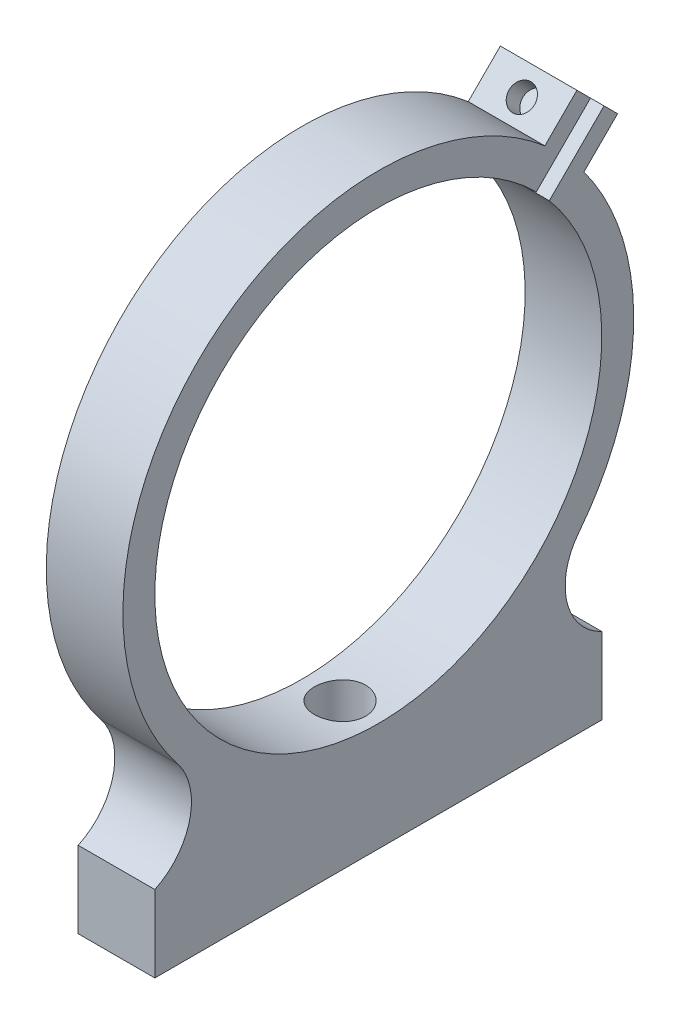
from build123d import *

# Parameters (mm, degrees)
SKETCH_1_W          = 70
SKETCH_1_H          = 12
SKETCH_1_R          = 40
SKETCH_1_R_2        = 35
SKETCH_1_W_2        = 35
EXTRUDE_1_DEPTH     = 12
FILLET_1_R          = 10
SKETCH_2_R          = 2
CUT_EXTRUDE_1_DEPTH = 27
CUT_EXTRUDE_START   = -6
SKETCH_2_3_R        = 4
SKETCH_2_3_R_2      = 2
CUT_EXTRUDE_2_DEPTH = 18
EXTRUDE_START       = -12
EXTRUDE_2_DEPTH     = 12
CUT_EXTRUDE_START_2 = -12
CUT_EXTRUDE_3_DEPTH = 12
SKETCH_4_R          = 2
CUT_EXTRUDE_4_DEPTH = 67.19801074


with BuildPart() as part:
    # 스케치1 → 보스-돌출1 (new body)
    # profile 1 of 7: a face of its own
    with BuildSketch(Plane(origin=(0, 0, 0), x_dir=(0, 0, -1), z_dir=(1, 0, 0))):
        with Locations((0, -46)):
            Rectangle(SKETCH_1_W, SKETCH_1_H)
    # profile 2 of 7: a face of its own
    with BuildSketch(Plane(origin=(0, 0, 0), x_dir=(0, 0, -1), z_dir=(1, 0, 0))):
        Circle(SKETCH_1_R)
        Circle(SKETCH_1_R_2, mode=Mode.SUBTRACT)
    # profile 3 of 7: a face of its own
    with BuildSketch(Plane(origin=(0, 0, 0), x_dir=(0, 0, -1), z_dir=(1, 0, 0))):
        with BuildLine():
            ThreePointArc((-18.119935206, -35.660453561), (-26.285525679, -38.897757113), (-35, -40))
            Line((-35, -40), (0, -40))
            ThreePointArc((0, -40), (-9.316164919, -38.899988062), (-18.119935206, -35.660453561))
        make_face()
    # profile 4 of 7: a face of its own
    with BuildSketch(Plane(origin=(0, 0, 0), x_dir=(0, 0, -1), z_dir=(1, 0, 0))):
        with Locations((17.5, -46)):
            Rectangle(SKETCH_1_W_2, SKETCH_1_H)
    # profile 5 of 7: a face of its own
    with BuildSketch(Plane(origin=(0, 0, 0), x_dir=(0, 0, -1), z_dir=(1, 0, 0))):
        with BuildLine():
            ThreePointArc((18.119935206, -35.660453561), (9.316164919, -38.899988062), (0, -40))
            Line((0, -40), (35, -40))
            ThreePointArc((35, -40), (26.285525679, -38.897757113), (18.119935206, -35.660453561))
        make_face()
    # profile 6 of 7: a face of its own
    with BuildSketch(Plane(origin=(0, 0, 0), x_dir=(0, 0, -1), z_dir=(1, 0, 0))):
        with BuildLine():
            ThreePointArc((-18.119935206, -35.660453561), (-9.316164919, -38.899988062), (0, -40))
            Line((0, -40), (0, -35))
            ThreePointArc((0, -35), (-35, 0), (0, 35))
            Line((0, 35), (0, 40))
            ThreePointArc((0, 40), (-38.899988062, 9.316164919), (-18.119935206, -35.660453561))
        make_face()
    # profile 7 of 7: a face of its own
    with BuildSketch(Plane(origin=(0, 0, 0), x_dir=(0, 0, -1), z_dir=(1, 0, 0))):
        with BuildLine():
            Line((0, -35), (0, -40))
            ThreePointArc((0, -40), (9.316164919, -38.899988062), (18.119935206, -35.660453561))
            ThreePointArc((18.119935206, -35.660453561), (34.093968735, -20.918921958), (40, 0))
            ThreePointArc((40, 0), (28.284271247, 28.284271247), (0, 40))
            Line((0, 40), (0, 35))
            ThreePointArc((0, 35), (24.748737342, 24.748737342), (35, 0))
            ThreePointArc((35, 0), (24.748737342, -24.748737342), (0, -35))
        make_face()
    extrude(amount=EXTRUDE_1_DEPTH)

    # 필렛1
    # the kernel refuses this fillet: 10 mm, written as the material it adds along each edge
    with BuildSketch(Plane(origin=(0, -35.660453561, -18.119935206), x_dir=(0, -0.24898498059862248, -0.9685073460931021), z_dir=(1, 0, 0))) as fillet_1_piece_1:
        with BuildLine():
            CenterArc((19.307998012, 9.821872198), FILLET_1_R, 156.16657794, 103.002878163)
            Line((10.16075687, 13.862661663), (9.977812048, 13.943477452))
            ThreePointArc((9.977812048, 13.943477452), (5.672446884, 6.497369179), (-0.132141038, 0.150129098))
            Line((-0.132141038, 0.150129098), (-0.049796996, -0.193701469))
            ThreePointArc((-0.049796996, -0.193701469), (8.714474321, -1.302242887), (17.391367655, -0.196437444))
            Line((17.391367655, -0.196437444), (17.428948642, 0))
        make_face()
    extrude(amount=12)
    with BuildSketch(Plane(origin=(0, -35.660453561, 18.119935206), x_dir=(0, 0.6339570106071373, 0.7733682878823399), z_dir=(1, 0, 0))) as fillet_1_piece_2:
        with BuildLine():
            CenterArc((19.336075357, 9.766480968), FILLET_1_R, 154.590671351, 103.002878163)
            Line((10.303420921, 14.057303016), (10.122767833, 14.143119457))
            ThreePointArc((10.122767833, 14.143119457), (4.101387619, 7.798494651), (-0.185668093, 0.074346212))
            Line((-0.185668093, 0.074346212), (0.042969056, -0.195329619))
            ThreePointArc((0.042969056, -0.195329619), (8.59381127, 0.734076129), (17.144653483, -0.195329619))
            Line((17.144653483, -0.195329619), (17.187622539, 0))
        make_face()
    extrude(amount=12)

    # 스케치2 → 컷-돌출1 (cut)
    with BuildSketch(Plane.XZ.offset(52)):
        with Locations(Location((6, 0, 0), (0, 0, 270))):
            Circle(SKETCH_2_R)
    extrude(amount=-CUT_EXTRUDE_1_DEPTH, mode=Mode.SUBTRACT)

    # 스케치2<3> → 컷-돌출2 (cut)
    with BuildSketch(Plane.XZ.offset(52).offset(CUT_EXTRUDE_START)):
        with Locations(Location((6, 0, 0), (0, 0, 270))):
            Circle(SKETCH_2_3_R)
        with Locations(Location((6, 0, 0), (0, 0, 270))):
            Circle(SKETCH_2_3_R_2, mode=Mode.SUBTRACT)
    extrude(amount=-CUT_EXTRUDE_2_DEPTH, mode=Mode.SUBTRACT)

    # 스케치3 → 보스-돌출2 (add)
    with BuildSketch(Plane(origin=(12, 0, 0), x_dir=(0, 0, -1), z_dir=(1, 0, 0)).offset(EXTRUDE_START)):
        with BuildLine():
            ThreePointArc((26.083289209, 30.325929896), (27.202941017, 29.325756597), (28.284271247, 28.284271247))
            Line((28.284271247, 28.284271247), (33.234018716, 33.234018716))
            Line((33.234018716, 33.234018716), (31.112698372, 35.355339059))
            Line((31.112698372, 35.355339059), (26.083289209, 30.325929896))
        make_face()
        with BuildLine():
            Line((35.355339059, 31.112698372), (30.325929896, 26.083289209))
            ThreePointArc((30.325929896, 26.083289209), (31.28870697, 24.920208991), (32.206903595, 23.721622221))
            Line((32.206903595, 23.721622221), (37.476659403, 28.991378029))
            Line((37.476659403, 28.991378029), (35.355339059, 31.112698372))
        make_face()
    extrude(amount=EXTRUDE_2_DEPTH)

    # 스케치3<3> → 컷-돌출3 (cut)
    with BuildSketch(Plane(origin=(12, 0, 0), x_dir=(0, 0, -1), z_dir=(1, 0, 0)).offset(CUT_EXTRUDE_START_2)):
        with BuildLine():
            Line((28.284271247, 28.284271247), (24.748737342, 24.748737342))
            ThreePointArc((24.748737342, 24.748737342), (25.787593916, 23.664319132), (26.778976355, 22.536335668))
            Line((26.778976355, 22.536335668), (30.325929896, 26.083289209))
            ThreePointArc((30.325929896, 26.083289209), (29.325756597, 27.202941017), (28.284271247, 28.284271247))
        make_face()
    extrude(amount=CUT_EXTRUDE_3_DEPTH, mode=Mode.SUBTRACT)

    # 스케치4 → 컷-돌출4 (cut, through all)
    with BuildSketch(Plane(origin=(0, -4.242640687, -4.242640687), x_dir=(1, 0, 0), z_dir=(0, -0.7071067811865483, -0.7071067811865468))):
        with Locations(Location((6, -43.273719933, 0), (0, 0, 270))):
            Circle(SKETCH_4_R)
    extrude(amount=-CUT_EXTRUDE_4_DEPTH, mode=Mode.SUBTRACT)


solid = part.part
